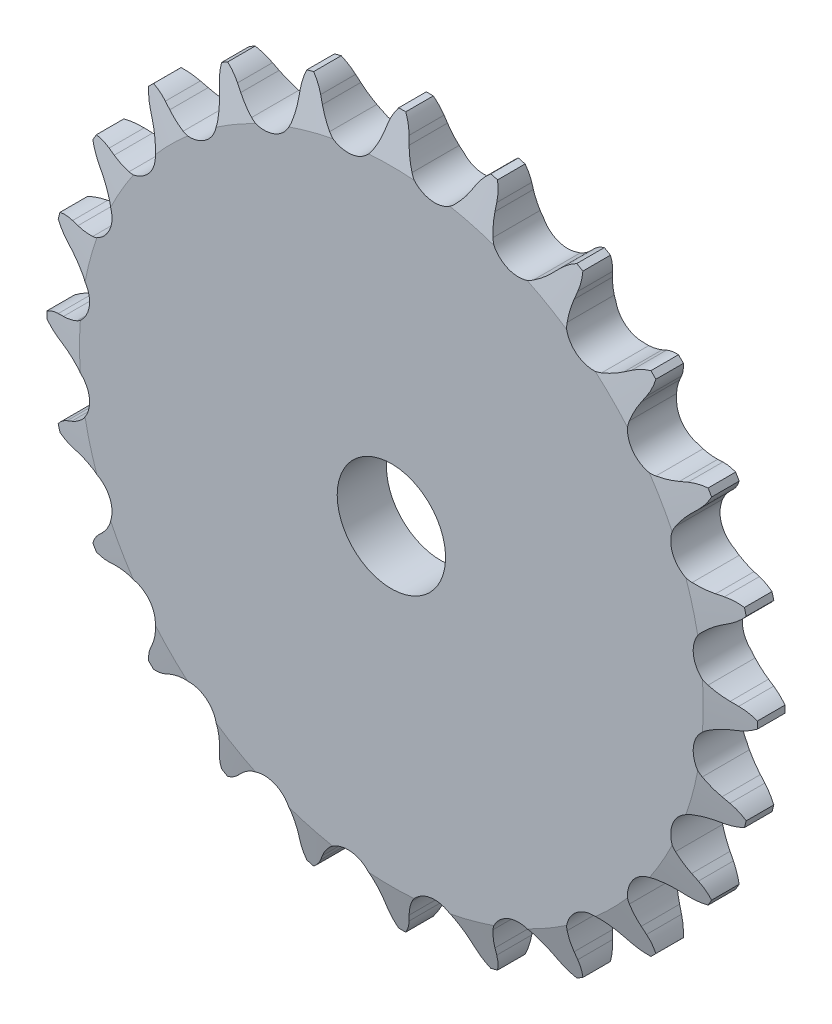
from build123d import *

# Parameters (mm, degrees)
CUT_EXTRUDE1_DEPTH      = 74.688294477
CIRPATTERN1_START       = -3.6068
CIRPATTERN1_DEPTH       = 7.2136
CUT_EXTRUDE2_DEPTH      = 74.688294623
CUT_EXTRUDE2_DEPTH_BACK = 74.688294623
SKETCH3_OUTSIDE_W       = 135.562
SKETCH3_OUTSIDE_H       = 135.562
SKETCH3_OUTSIDE_R       = 52.07
SKETCH3_OUTSIDE_R_2     = 7.9375


# Read off the part's stored shape, not the designer's step: CirPattern1
with BuildPart() as part:
    # Sketch1 → Revolve1 (revolve)
    with BuildSketch(Plane(origin=(0, 0, 0), x_dir=(0, 0, -1), z_dir=(1, 0, 0)), mode=Mode.PRIVATE) as revolve1_sk:
        Polygon((3.6068, 0), (-3.6068, 0), (-3.6068, 45.693038616), (-2.0193, 52.043038616), (2.0193, 52.043038616), (3.6068, 45.693038616), align=None)
    revolve(revolve1_sk.sketch.rotate(Axis((0, 0, -3.6068), (0, 0, 1)), 90), axis=Axis((0, 0, -3.6068), (0, 0, 1)))

    # Sketch0 → Cut-Extrude1 (cut, symmetric)
    with BuildSketch(Plane.XY):
        with BuildLine():
            Line((11.405728114, -48.542621869), (10.898875181, -47.640650527))
            ThreePointArc((10.898875181, -47.640650527), (10.122869866, -46.457045721), (9.192789878, -45.390248738))
            ThreePointArc((9.192789878, -45.390248738), (5.825243983, -44.247120942), (2.868307677, -46.222882616))
            ThreePointArc((2.868307677, -46.222882616), (2.246026772, -47.494051787), (1.802802662, -48.838171193))
            Line((1.802802662, -48.838171193), (1.546667686, -49.840591798))
            ThreePointArc((1.546667686, -49.840591798), (-1.017939041, -53.550640512), (-5.380423903, -54.695365348))
            ThreePointArc((-5.380423903, -54.695365348), (7.173636819, -54.489181374), (19.353292635, -51.439109792))
            ThreePointArc((19.353292635, -51.439109792), (14.843179251, -51.462484675), (11.405728114, -48.542621869))
        make_face()
    extrude(amount=CUT_EXTRUDE1_DEPTH, both=True, mode=Mode.SUBTRACT)

    # CirPattern1 outline → CirPattern1 (cut)
    with BuildSketch(Plane.XY.offset(CIRPATTERN1_START)):
        with BuildLine():
            ThreePointArc((-11.405728114, -48.542621868), (-12.100793448, -49.545506005), (-12.971206295, -50.40065154))
            ThreePointArc((-12.971206295, -50.40065154), (-6.792979662, -51.597803206), (-0.515425346, -52.040486211))
            ThreePointArc((-0.515425346, -52.040486211), (-1.134851643, -50.989199632), (-1.546667686, -49.840591798))
            Line((-1.546667686, -49.840591798), (-1.802802662, -48.838171193))
            ThreePointArc((-1.802802662, -48.838171193), (-2.246026772, -47.494051788), (-2.868307677, -46.222882616))
            ThreePointArc((-2.868307677, -46.222882616), (-5.825243983, -44.247120942), (-9.192789878, -45.390248738))
            ThreePointArc((-9.192789878, -45.390248738), (-10.122869866, -46.457045721), (-10.898875181, -47.640650527))
            Line((-10.898875181, -47.640650527), (-11.405728114, -48.542621868))
        make_face()
        with BuildLine():
            ThreePointArc((-23.580842391, -43.936552479), (-24.511789463, -44.725368021), (-25.573871662, -45.326095757))
            ThreePointArc((-25.573871662, -45.326095757), (-19.916008648, -48.081498186), (-13.966931601, -50.133847748))
            ThreePointArc((-13.966931601, -50.133847748), (-14.29315847, -48.958063567), (-14.393660639, -47.742007761))
            Line((-14.393660639, -47.742007761), (-14.381622484, -46.7074512))
            ThreePointArc((-14.381622484, -46.7074512), (-14.461860397, -45.294416712), (-14.733934803, -43.90550343))
            ThreePointArc((-14.733934803, -43.90550343), (-17.078751198, -41.231752772), (-20.627413994, -41.46434442))
            ThreePointArc((-20.627413994, -41.46434442), (-21.801909652, -42.254068762), (-22.857812693, -43.196498258))
            Line((-22.857812693, -43.196498258), (-23.580842391, -43.936552479))
        make_face()
        with BuildLine():
            ThreePointArc((-34.148961229, -36.336279648), (-35.252347534, -36.857270119), (-36.433719939, -37.162641453))
            ThreePointArc((-36.433719939, -37.162641453), (-31.681794557, -41.288518524), (-26.466614549, -44.81067041))
            ThreePointArc((-26.466614549, -44.81067041), (-26.477410168, -43.590516378), (-26.259749406, -42.389884793))
            Line((-26.259749406, -42.389884793), (-25.9803585, -41.393695596))
            ThreePointArc((-25.9803585, -41.393695596), (-25.692142135, -40.008041991), (-25.595468622, -38.596036743))
            ThreePointArc((-25.595468622, -38.596036743), (-27.168369744, -35.406508789), (-30.656313935, -34.712713552))
            ThreePointArc((-30.656313935, -34.712713552), (-31.995185324, -35.171546846), (-33.259028043, -35.808576019))
            Line((-33.259028043, -35.808576019), (-34.148961229, -36.336279648))
        make_face()
        with BuildLine():
            ThreePointArc((-42.389884793, -26.259749406), (-43.590516378, -26.477410168), (-44.810670411, -26.466614549))
            ThreePointArc((-44.810670411, -26.466614549), (-41.288518524, -31.681794557), (-37.162641452, -36.433719938))
            ThreePointArc((-37.162641452, -36.433719938), (-36.857270119, -35.252347534), (-36.336279648, -34.148961229))
            Line((-36.336279648, -34.148961229), (-35.808576019, -33.259028043))
            ThreePointArc((-35.808576019, -33.259028043), (-35.171546846, -31.995185324), (-34.712713552, -30.656313935))
            ThreePointArc((-34.712713552, -30.656313935), (-35.406508789, -27.168369744), (-38.596036743, -25.595468622))
            ThreePointArc((-38.596036743, -25.595468622), (-40.008041991, -25.692142135), (-41.393695596, -25.9803585))
            Line((-41.393695596, -25.9803585), (-42.389884793, -26.259749406))
        make_face()
        with BuildLine():
            ThreePointArc((-47.742007761, -14.393660639), (-48.958063567, -14.29315847), (-50.133847748, -13.966931601))
            ThreePointArc((-50.133847748, -13.966931601), (-48.081498186, -19.916008648), (-45.326095756, -25.573871661))
            ThreePointArc((-45.326095756, -25.573871661), (-44.725368021, -24.511789463), (-43.936552479, -23.580842391))
            Line((-43.936552479, -23.580842391), (-43.196498258, -22.857812693))
            ThreePointArc((-43.196498258, -22.857812693), (-42.254068762, -21.801909652), (-41.46434442, -20.627413994))
            ThreePointArc((-41.46434442, -20.627413994), (-41.231752772, -17.078751198), (-43.905503431, -14.733934803))
            ThreePointArc((-43.905503431, -14.733934803), (-45.294416712, -14.461860397), (-46.7074512, -14.381622484))
            Line((-46.7074512, -14.381622484), (-47.742007761, -14.393660639))
        make_face()
        with BuildLine():
            ThreePointArc((-49.840591798, -1.546667686), (-50.989199632, -1.134851643), (-52.040486211, -0.515425346))
            ThreePointArc((-52.040486211, -0.515425346), (-51.597803204, -6.792979662), (-50.400651538, -12.971206295))
            ThreePointArc((-50.400651538, -12.971206295), (-49.545506005, -12.100793448), (-48.542621868, -11.405728114))
            Line((-48.542621868, -11.405728114), (-47.640650527, -10.898875181))
            ThreePointArc((-47.640650527, -10.898875181), (-46.457045721, -10.122869866), (-45.390248738, -9.192789878))
            ThreePointArc((-45.390248738, -9.192789878), (-44.247120942, -5.825243983), (-46.222882616, -2.868307677))
            ThreePointArc((-46.222882616, -2.868307677), (-47.494051788, -2.246026772), (-48.838171193, -1.802802662))
            Line((-48.838171193, -1.802802662), (-49.840591798, -1.546667686))
        make_face()
        with BuildLine():
            ThreePointArc((-48.542621868, 11.405728114), (-49.545506005, 12.100793448), (-50.40065154, 12.971206295))
            ThreePointArc((-50.40065154, 12.971206295), (-51.597803205, 6.792979662), (-52.04048621, 0.515425346))
            ThreePointArc((-52.04048621, 0.515425346), (-50.989199632, 1.134851643), (-49.840591798, 1.546667686))
            Line((-49.840591798, 1.546667686), (-48.838171193, 1.802802662))
            ThreePointArc((-48.838171193, 1.802802662), (-47.494051788, 2.246026772), (-46.222882616, 2.868307677))
            ThreePointArc((-46.222882616, 2.868307677), (-44.247120942, 5.825243983), (-45.390248738, 9.192789878))
            ThreePointArc((-45.390248738, 9.192789878), (-46.457045721, 10.122869866), (-47.640650527, 10.898875181))
            Line((-47.640650527, 10.898875181), (-48.542621868, 11.405728114))
        make_face()
        with BuildLine():
            ThreePointArc((-43.936552479, 23.580842391), (-44.725368021, 24.511789463), (-45.326095757, 25.573871662))
            ThreePointArc((-45.326095757, 25.573871662), (-48.081498186, 19.916008648), (-50.133847747, 13.966931601))
            ThreePointArc((-50.133847747, 13.966931601), (-48.958063567, 14.29315847), (-47.742007761, 14.393660639))
            Line((-47.742007761, 14.393660639), (-46.7074512, 14.381622484))
            ThreePointArc((-46.7074512, 14.381622484), (-45.294416712, 14.461860397), (-43.90550343, 14.733934803))
            ThreePointArc((-43.90550343, 14.733934803), (-41.231752754, 17.078751242), (-41.464344468, 20.627414076))
            ThreePointArc((-41.464344468, 20.627414076), (-42.254068762, 21.801909652), (-43.196498258, 22.857812693))
            Line((-43.196498258, 22.857812693), (-43.936552479, 23.580842391))
        make_face()
        with BuildLine():
            ThreePointArc((-36.336279648, 34.148961229), (-36.857270119, 35.252347534), (-37.162641453, 36.433719939))
            ThreePointArc((-37.162641453, 36.433719939), (-41.288518524, 31.681794557), (-44.81067041, 26.466614548))
            ThreePointArc((-44.81067041, 26.466614548), (-43.590516378, 26.477410168), (-42.389884793, 26.259749406))
            Line((-42.389884793, 26.259749406), (-41.393695596, 25.9803585))
            ThreePointArc((-41.393695596, 25.9803585), (-40.008041991, 25.692142135), (-38.596036743, 25.595468622))
            ThreePointArc((-38.596036743, 25.595468622), (-35.406508815, 27.16836971), (-34.712713552, 30.656313935))
            ThreePointArc((-34.712713552, 30.656313935), (-35.171546846, 31.995185324), (-35.808576019, 33.259028043))
            Line((-35.808576019, 33.259028043), (-36.336279648, 34.148961229))
        make_face()
        with BuildLine():
            ThreePointArc((-26.259749406, 42.389884793), (-26.477410168, 43.590516378), (-26.466614549, 44.810670411))
            ThreePointArc((-26.466614549, 44.810670411), (-31.681794558, 41.288518524), (-36.433719938, 37.162641452))
            ThreePointArc((-36.433719938, 37.162641452), (-35.252347534, 36.857270119), (-34.148961229, 36.336279648))
            Line((-34.148961229, 36.336279648), (-33.259028043, 35.808576019))
            ThreePointArc((-33.259028043, 35.808576019), (-31.995185324, 35.171546846), (-30.656313935, 34.712713552))
            ThreePointArc((-30.656313935, 34.712713552), (-27.168369744, 35.406508789), (-25.595468622, 38.596036743))
            ThreePointArc((-25.595468622, 38.596036743), (-25.692142135, 40.008041991), (-25.9803585, 41.393695596))
            Line((-25.9803585, 41.393695596), (-26.259749406, 42.389884793))
        make_face()
        with BuildLine():
            ThreePointArc((-14.393660639, 47.742007761), (-14.29315847, 48.958063567), (-13.966931601, 50.133847748))
            ThreePointArc((-13.966931601, 50.133847748), (-19.916008648, 48.081498187), (-25.573871662, 45.326095757))
            ThreePointArc((-25.573871662, 45.326095757), (-24.511789463, 44.725368021), (-23.580842391, 43.936552479))
            Line((-23.580842391, 43.936552479), (-22.857812693, 43.196498258))
            ThreePointArc((-22.857812693, 43.196498258), (-21.801909652, 42.254068762), (-20.627413994, 41.46434442))
            ThreePointArc((-20.627413994, 41.46434442), (-17.078751198, 41.231752772), (-14.733934803, 43.905503431))
            ThreePointArc((-14.733934803, 43.905503431), (-14.461860397, 45.294416712), (-14.381622484, 46.7074512))
            Line((-14.381622484, 46.7074512), (-14.393660639, 47.742007761))
        make_face()
        with BuildLine():
            ThreePointArc((-1.546667686, 49.840591798), (-1.134851643, 50.989199632), (-0.515425346, 52.040486211))
            ThreePointArc((-0.515425346, 52.040486211), (-6.792979662, 51.597803206), (-12.971206295, 50.40065154))
            ThreePointArc((-12.971206295, 50.40065154), (-12.100793448, 49.545506005), (-11.405728114, 48.542621868))
            Line((-11.405728114, 48.542621868), (-10.898875181, 47.640650527))
            ThreePointArc((-10.898875181, 47.640650527), (-10.122869866, 46.457045721), (-9.192789878, 45.390248738))
            ThreePointArc((-9.192789878, 45.390248738), (-5.825243983, 44.247120942), (-2.868307677, 46.222882616))
            ThreePointArc((-2.868307677, 46.222882616), (-2.246026772, 47.494051788), (-1.802802662, 48.838171193))
            Line((-1.802802662, 48.838171193), (-1.546667686, 49.840591798))
        make_face()
        with BuildLine():
            ThreePointArc((11.405728114, 48.542621868), (12.100793448, 49.545506005), (12.971206295, 50.40065154))
            ThreePointArc((12.971206295, 50.40065154), (6.792979662, 51.597803206), (0.515425346, 52.040486211))
            ThreePointArc((0.515425346, 52.040486211), (1.134851643, 50.989199632), (1.546667686, 49.840591798))
            Line((1.546667686, 49.840591798), (1.802802662, 48.838171193))
            ThreePointArc((1.802802662, 48.838171193), (2.246026772, 47.494051788), (2.868307677, 46.222882616))
            ThreePointArc((2.868307677, 46.222882616), (5.825243983, 44.247120942), (9.192789878, 45.390248738))
            ThreePointArc((9.192789878, 45.390248738), (10.122869866, 46.457045721), (10.898875181, 47.640650527))
            Line((10.898875181, 47.640650527), (11.405728114, 48.542621868))
        make_face()
        with BuildLine():
            ThreePointArc((23.580842391, 43.936552479), (24.511789463, 44.725368021), (25.573871662, 45.326095757))
            ThreePointArc((25.573871662, 45.326095757), (19.916008648, 48.081498188), (13.966931601, 50.133847749))
            ThreePointArc((13.966931601, 50.133847749), (14.29315847, 48.958063567), (14.393660639, 47.742007761))
            Line((14.393660639, 47.742007761), (14.381622484, 46.7074512))
            ThreePointArc((14.381622484, 46.7074512), (14.461860397, 45.294416712), (14.733934803, 43.90550343))
            ThreePointArc((14.733934803, 43.90550343), (17.078751242, 41.231752754), (20.627414076, 41.464344468))
            ThreePointArc((20.627414076, 41.464344468), (21.801909652, 42.254068762), (22.857812693, 43.196498258))
            Line((22.857812693, 43.196498258), (23.580842391, 43.936552479))
        make_face()
        with BuildLine():
            ThreePointArc((34.148961229, 36.336279648), (35.252347534, 36.857270119), (36.433719939, 37.162641453))
            ThreePointArc((36.433719939, 37.162641453), (31.681794559, 41.288518526), (26.46661455, 44.810670412))
            ThreePointArc((26.46661455, 44.810670412), (26.477410168, 43.590516378), (26.259749406, 42.389884793))
            Line((26.259749406, 42.389884793), (25.9803585, 41.393695596))
            ThreePointArc((25.9803585, 41.393695596), (25.692142135, 40.008041991), (25.595468622, 38.596036743))
            ThreePointArc((25.595468622, 38.596036743), (27.16836971, 35.406508815), (30.656313935, 34.712713552))
            ThreePointArc((30.656313935, 34.712713552), (31.995185324, 35.171546846), (33.259028043, 35.808576019))
            Line((33.259028043, 35.808576019), (34.148961229, 36.336279648))
        make_face()
        with BuildLine():
            ThreePointArc((42.389884793, 26.259749406), (43.590516378, 26.477410168), (44.810670411, 26.466614549))
            ThreePointArc((44.810670411, 26.466614549), (41.288518526, 31.681794559), (37.162641454, 36.43371994))
            ThreePointArc((37.162641454, 36.43371994), (36.857270119, 35.252347534), (36.336279648, 34.148961229))
            Line((36.336279648, 34.148961229), (35.808576019, 33.259028043))
            ThreePointArc((35.808576019, 33.259028043), (35.171546846, 31.995185324), (34.712713552, 30.656313935))
            ThreePointArc((34.712713552, 30.656313935), (35.406508815, 27.16836971), (38.596036828, 25.595468622))
            ThreePointArc((38.596036828, 25.595468622), (40.008041991, 25.692142135), (41.393695596, 25.9803585))
            Line((41.393695596, 25.9803585), (42.389884793, 26.259749406))
        make_face()
        with BuildLine():
            ThreePointArc((47.742007761, 14.393660639), (48.958063567, 14.29315847), (50.133847748, 13.966931601))
            ThreePointArc((50.133847748, 13.966931601), (48.081498188, 19.916008649), (45.326095758, 25.573871663))
            ThreePointArc((45.326095758, 25.573871663), (44.725368021, 24.511789463), (43.936552479, 23.580842391))
            Line((43.936552479, 23.580842391), (43.196498258, 22.857812693))
            ThreePointArc((43.196498258, 22.857812693), (42.254068762, 21.801909652), (41.46434442, 20.627413994))
            ThreePointArc((41.46434442, 20.627413994), (41.231752754, 17.078751242), (43.905503432, 14.733934803))
            ThreePointArc((43.905503432, 14.733934803), (45.294416712, 14.461860397), (46.7074512, 14.381622484))
            Line((46.7074512, 14.381622484), (47.742007761, 14.393660639))
        make_face()
        with BuildLine():
            ThreePointArc((49.840591798, 1.546667686), (50.989199632, 1.134851643), (52.040486211, 0.515425346))
            ThreePointArc((52.040486211, 0.515425346), (51.597803208, 6.792979662), (50.400651541, 12.971206295))
            ThreePointArc((50.400651541, 12.971206295), (49.545506005, 12.100793448), (48.542621868, 11.405728114))
            Line((48.542621868, 11.405728114), (47.640650527, 10.898875181))
            ThreePointArc((47.640650527, 10.898875181), (46.457045721, 10.122869866), (45.390248738, 9.192789878))
            ThreePointArc((45.390248738, 9.192789878), (44.247120942, 5.825243983), (46.222882616, 2.868307677))
            ThreePointArc((46.222882616, 2.868307677), (47.494051788, 2.246026772), (48.838171193, 1.802802662))
            Line((48.838171193, 1.802802662), (49.840591798, 1.546667686))
        make_face()
        with BuildLine():
            ThreePointArc((48.542621868, -11.405728114), (49.545506005, -12.100793448), (50.40065154, -12.971206295))
            ThreePointArc((50.40065154, -12.971206295), (51.597803208, -6.792979662), (52.040486213, -0.515425346))
            ThreePointArc((52.040486213, -0.515425346), (50.989199632, -1.134851643), (49.840591798, -1.546667686))
            Line((49.840591798, -1.546667686), (48.838171193, -1.802802662))
            ThreePointArc((48.838171193, -1.802802662), (47.494051788, -2.246026772), (46.222882616, -2.868307677))
            ThreePointArc((46.222882616, -2.868307677), (44.247120942, -5.825243983), (45.390248738, -9.192789878))
            ThreePointArc((45.390248738, -9.192789878), (46.457045721, -10.122869866), (47.640650527, -10.898875181))
            Line((47.640650527, -10.898875181), (48.542621868, -11.405728114))
        make_face()
        with BuildLine():
            ThreePointArc((43.936552479, -23.580842391), (44.725368021, -24.511789463), (45.326095757, -25.573871662))
            ThreePointArc((45.326095757, -25.573871662), (48.081498188, -19.916008649), (50.13384775, -13.966931601))
            ThreePointArc((50.13384775, -13.966931601), (48.958063567, -14.29315847), (47.742007761, -14.393660639))
            Line((47.742007761, -14.393660639), (46.7074512, -14.381622484))
            ThreePointArc((46.7074512, -14.381622484), (45.294416712, -14.461860397), (43.90550343, -14.733934803))
            ThreePointArc((43.90550343, -14.733934803), (41.231752772, -17.078751198), (41.46434442, -20.627413994))
            ThreePointArc((41.46434442, -20.627413994), (42.254068762, -21.801909652), (43.196498258, -22.857812693))
            Line((43.196498258, -22.857812693), (43.936552479, -23.580842391))
        make_face()
        with BuildLine():
            ThreePointArc((36.336279648, -34.148961229), (36.857270119, -35.252347534), (37.162641453, -36.433719939))
            ThreePointArc((37.162641453, -36.433719939), (41.288518526, -31.681794559), (44.810670412, -26.46661455))
            ThreePointArc((44.810670412, -26.46661455), (43.590516378, -26.477410168), (42.389884793, -26.259749406))
            Line((42.389884793, -26.259749406), (41.393695596, -25.9803585))
            ThreePointArc((41.393695596, -25.9803585), (40.008041991, -25.692142135), (38.596036743, -25.595468622))
            ThreePointArc((38.596036743, -25.595468622), (35.406508789, -27.168369744), (34.712713552, -30.656313935))
            ThreePointArc((34.712713552, -30.656313935), (35.171546846, -31.995185324), (35.808576019, -33.259028043))
            Line((35.808576019, -33.259028043), (36.336279648, -34.148961229))
        make_face()
        with BuildLine():
            ThreePointArc((26.259749406, -42.389884793), (26.477410168, -43.590516378), (26.466614549, -44.810670411))
            ThreePointArc((26.466614549, -44.810670411), (31.681794559, -41.288518525), (36.43371994, -37.162641454))
            ThreePointArc((36.43371994, -37.162641454), (35.252347534, -36.857270119), (34.148961229, -36.336279648))
            Line((34.148961229, -36.336279648), (33.259028043, -35.808576019))
            ThreePointArc((33.259028043, -35.808576019), (31.995185324, -35.171546846), (30.656313935, -34.712713552))
            ThreePointArc((30.656313935, -34.712713552), (27.16836971, -35.406508815), (25.595468622, -38.596036828))
            ThreePointArc((25.595468622, -38.596036828), (25.692142135, -40.008041991), (25.9803585, -41.393695596))
            Line((25.9803585, -41.393695596), (26.259749406, -42.389884793))
        make_face()
        with BuildLine():
            ThreePointArc((25.573871662, -45.326095757), (24.511789463, -44.725368021), (23.580842391, -43.936552479))
            Line((23.580842391, -43.936552479), (22.857812693, -43.196498258))
            ThreePointArc((22.857812693, -43.196498258), (21.801909652, -42.254068762), (20.627413994, -41.46434442))
            ThreePointArc((20.627413994, -41.46434442), (17.078751242, -41.231752754), (14.733934803, -43.905503432))
            ThreePointArc((14.733934803, -43.905503432), (14.461860397, -45.294416712), (14.381622484, -46.7074512))
            Line((14.381622484, -46.7074512), (14.393660639, -47.742007762))
            ThreePointArc((14.393660639, -47.742007762), (14.29315847, -48.958063568), (13.966931601, -50.133847748))
            ThreePointArc((13.966931601, -50.133847748), (19.916008648, -48.081498187), (25.573871662, -45.326095757))
        make_face()
    extrude(amount=CIRPATTERN1_DEPTH, mode=Mode.SUBTRACT)

    # Sketch3 outside → Cut-Extrude2 (cut, two sides: drawn at the far end of the back side and taken through both)
    # profile 1 of 2: a face of its own
    with BuildSketch(Plane.XY.offset(-CUT_EXTRUDE2_DEPTH_BACK)):
        Rectangle(SKETCH3_OUTSIDE_W, SKETCH3_OUTSIDE_H)
        Circle(SKETCH3_OUTSIDE_R, mode=Mode.SUBTRACT)
    # profile 2 of 2: a face of its own
    with BuildSketch(Plane.XY.offset(-CUT_EXTRUDE2_DEPTH_BACK)):
        with Locations(Location((0, 0, 0), (0, 0, 180))):
            Circle(SKETCH3_OUTSIDE_R_2)
    extrude(amount=CUT_EXTRUDE2_DEPTH + CUT_EXTRUDE2_DEPTH_BACK, mode=Mode.SUBTRACT)


solid = part.part
